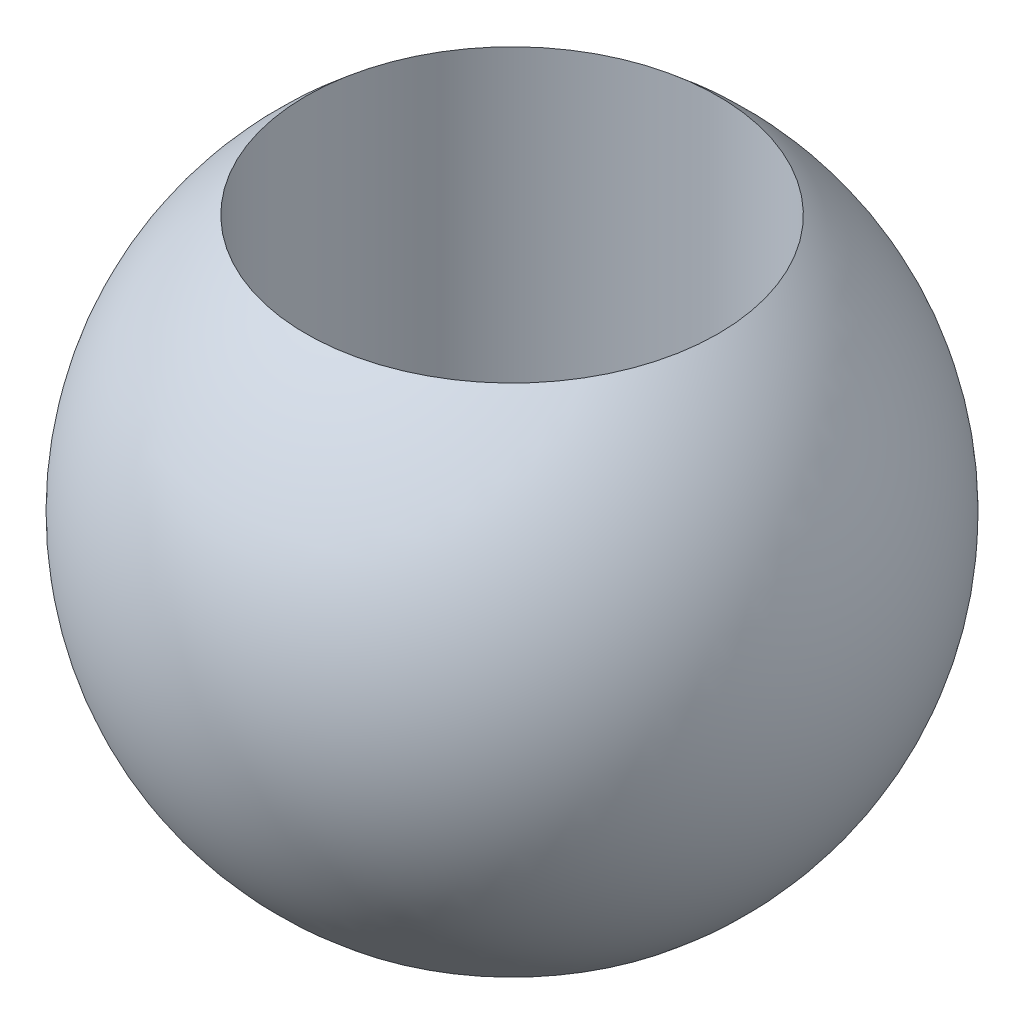
from build123d import *


with BuildPart() as part:
    # Sketch1 → Revolve1 (revolve)
    with BuildSketch(Plane.XY):
        with BuildLine():
            ThreePointArc((1.5875, -1.982786864), (2.54, 0), (1.5875, 1.982786864))
            Line((1.5875, 1.982786864), (1.5875, -1.982786864))
        make_face()
    revolve(axis=Axis((0, 2.54, 0), (0, -1, 0)))


solid = part.part
